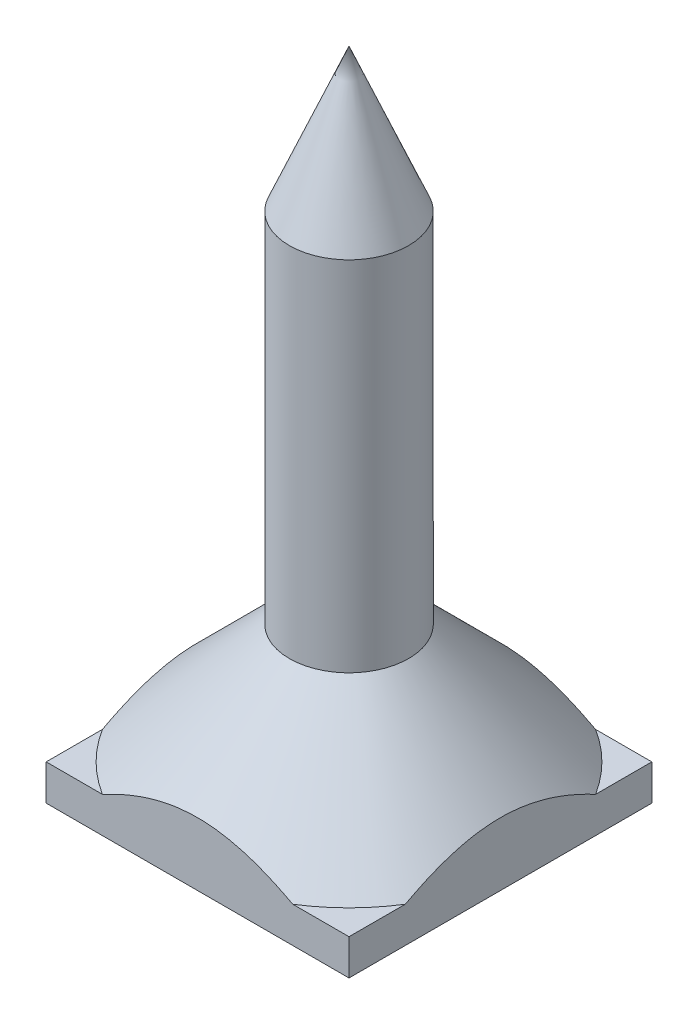
from build123d import *

# Parameters (mm, degrees)
SKETCH1_W           = 25.4
SKETCH1_H           = 25.4
BOSS_EXTRUDE1_DEPTH = 3
SKETCH2_R           = 5
BOSS_EXTRUDE2_DEPTH = 40
CHAMFER1_SIZE       = 10


with BuildPart() as part:
    # Sketch1 → Boss-Extrude1 (new body)
    with BuildSketch(Plane(origin=(0, 0, 0), x_dir=(1, 0, 0), z_dir=(0, 1, 0))):
        Rectangle(SKETCH1_W, SKETCH1_H)
    extrude(amount=BOSS_EXTRUDE1_DEPTH)

    # Sketch2 → Boss-Extrude2 (add)
    with BuildSketch(Plane(origin=(0, 3, 0), x_dir=(1, 0, 0), z_dir=(0, 1, 0))):
        with Locations(Location((0, 0, 0), (0, 0, 270))):
            Circle(SKETCH2_R)
    extrude(amount=BOSS_EXTRUDE2_DEPTH)

    # Chamfer1
    # the kernel refuses this chamfer: 10 mm, written as the material it adds along each edge
    with BuildSketch(Plane(origin=(0, 3, 0), x_dir=(0, 0, 1), z_dir=(-1, 0, 0))) as chamfer1_piece_1_section:
        Polygon((5 + CHAMFER1_SIZE, 0), (5, CHAMFER1_SIZE), (5, 0), align=None)
    chamfer1_piece_1 = revolve(axis=Axis((0, 3, 0), (0, 1, 0)), mode=Mode.PRIVATE)
    chamfer1_piece_1 = split(chamfer1_piece_1, bisect_by=Plane(origin=(0, 7.901138133, -12.7), z_dir=(0, 0, 1)), keep=Keep.TOP, mode=Mode.PRIVATE)
    chamfer1_piece_1 = split(chamfer1_piece_1, bisect_by=Plane(origin=(-12.7, 7.901138133, -9.901138133), z_dir=(1, 0, 0)), keep=Keep.TOP, mode=Mode.PRIVATE)
    chamfer1_piece_1 = split(chamfer1_piece_1, bisect_by=Plane(origin=(12.7, 7.901138133, -9.901138133), z_dir=(-1, 0, 0)), keep=Keep.TOP, mode=Mode.PRIVATE)
    chamfer1_piece_1 = split(chamfer1_piece_1, bisect_by=Plane(origin=(0, 7.901138133, 12.7), z_dir=(0, 0, -1)), keep=Keep.TOP, mode=Mode.PRIVATE)
    add(chamfer1_piece_1)

    # Sketch3 → Revolve1 (revolve)
    with BuildSketch(Plane(origin=(0, 0, 0), x_dir=(0, 0, -1), z_dir=(1, 0, 0)), mode=Mode.PRIVATE) as revolve1_sk:
        Polygon((0, 55), (0, 43), (5, 43), align=None)
    revolve(revolve1_sk.sketch.rotate(Axis((0, 0, 0), (0, 1, 0)), 327.850947574), axis=Axis((0, 0, 0), (0, 1, 0)))


solid = part.part
